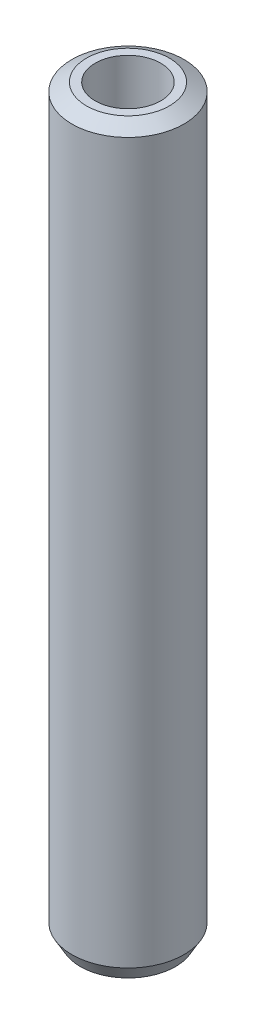
from build123d import *
from OCP.BRepFilletAPI import BRepFilletAPI_MakeChamfer

# Parameters (mm, degrees)
SKETCH1_R           = 10
BOSS_EXTRUDE1_DEPTH = 132.510919684
SKETCH2_R           = 5.844992847
CUT_EXTRUDE1_DEPTH  = 134.263437729
CHAMFER1_SIZE       = 1.502102242
CHAMFER1_SIZE2      = 2.601717401


with BuildPart() as part:
    # Sketch1 → Boss-Extrude1 (new body)
    with BuildSketch(Plane(origin=(0, 0, 0), x_dir=(1, 0, 0), z_dir=(0, 1, 0))):
        Circle(SKETCH1_R)
    extrude(amount=BOSS_EXTRUDE1_DEPTH)

    # Sketch2 → Cut-Extrude1 (cut, through all)
    with BuildSketch(Plane(origin=(0, 0, 0), x_dir=(1, 0, 0), z_dir=(0, 1, 0))):
        Circle(SKETCH2_R)
    extrude(amount=CUT_EXTRUDE1_DEPTH, mode=Mode.SUBTRACT)

    # Chamfer1: one chamfer whose edges measure the first distance from different faces: ONE call of the kernel's chamfer builder (chamfer() names one face for all edges)
    chamfer1_edges_1 = [part.edges().sort_by_distance(p)[0] for p in [
        (-10, 132.510919684, 0),
    ]]
    chamfer1_side_1 = [part.faces().sort_by_distance(p)[0] for p in [
        (-10, 66.255459842, 0),
    ]]
    chamfer1_edges_2 = [part.edges().sort_by_distance(p)[0] for p in [
        (-10, 0, 0),
    ]]
    chamfer1_side_2 = [part.faces().sort_by_distance(p)[0] for p in [
        (-9.717157288, 0, 0),
    ]]
    chamfer1 = BRepFilletAPI_MakeChamfer(part.part.solid().wrapped)
    for e in chamfer1_edges_1:
        chamfer1.Add(CHAMFER1_SIZE, CHAMFER1_SIZE2, e.wrapped, chamfer1_side_1[0].wrapped)  # the first distance lies on this face
    for e in chamfer1_edges_2:
        chamfer1.Add(CHAMFER1_SIZE, CHAMFER1_SIZE2, e.wrapped, chamfer1_side_2[0].wrapped)  # the first distance lies on this face
    add(Compound.cast(chamfer1.Shape()), mode=Mode.REPLACE)


solid = part.part
